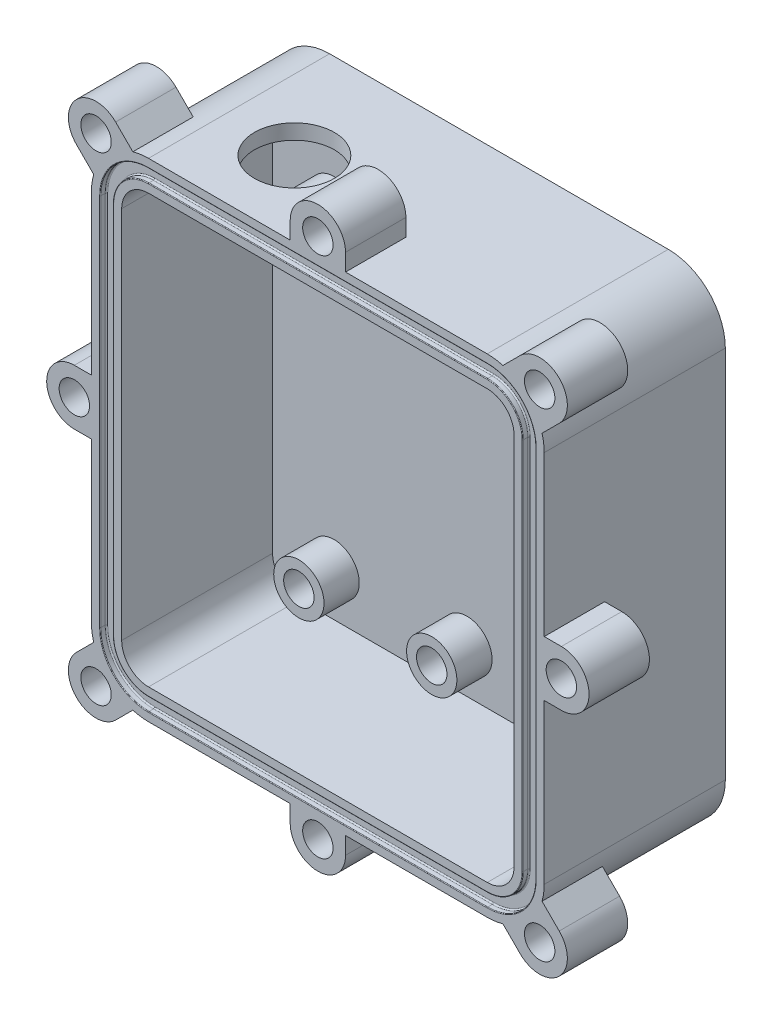
from build123d import *

# Parameters (mm, degrees)
BOSS_EXTRUDE1_DEPTH     = 30
SHELL1_T                = 6
CUT_EXTRUDE4_DEPTH      = 1.2446
FILLET1_R               = 0.254
FILLET2_R               = 0.127
BOSS_EXTRUDE7_START     = -12
BOSS_EXTRUDE7_DEPTH     = 12
SKETCH17_R              = 3.025
CUT_EXTRUDE5_DEPTH      = 9
MIRROR3_START           = -12
MIRROR3_COPY_1_DEPTH    = 12
MIRROR3_COPY_2_SKETCH_R = 3.025
MIRROR3_COPY_2_DEPTH    = 9
BOSS_EXTRUDE8_DEPTH     = 12
SKETCH19_R              = 3.025
CUT_EXTRUDE6_DEPTH      = 9
BOSS_EXTRUDE9_DEPTH     = 12
SKETCH21_R              = 3.025
CUT_EXTRUDE9_DEPTH      = 9
CUT_EXTRUDE12_DEPTH     = 6
SKETCH28_R              = 5
SKETCH28_R_2            = 3.025
BOSS_EXTRUDE12_DEPTH    = 7
SKETCH29_R              = 12.7
CUT_EXTRUDE13_DEPTH     = 3
SKETCH30_R              = 3.025
CUT_EXTRUDE14_DEPTH     = 9


with BuildPart() as part:
    # Sketch2 → Boss-Extrude1 (new body)
    with BuildSketch(Plane.XY):
        with BuildLine():
            Line((25.377997498, 138.848000793), (92.709997498, 138.848000793))
            ThreePointArc((92.709997498, 138.848000793), (96.481705068, 137.285708364), (98.043997498, 133.514000793))
            Line((98.043997498, 133.514000793), (98.043997498, 59.182000793))
            ThreePointArc((98.043997498, 59.182000793), (96.481705068, 55.410293223), (92.709997498, 53.848000793))
            Line((92.709997498, 53.848000793), (25.377997498, 53.848000793))
            ThreePointArc((25.377997498, 53.848000793), (21.606289927, 55.410293223), (20.043997498, 59.182000793))
            Line((20.043997498, 59.182000793), (20.043997498, 133.514000793))
            ThreePointArc((20.043997498, 133.514000793), (21.606289927, 137.285708364), (25.377997498, 138.848000793))
        make_face()
    extrude(amount=BOSS_EXTRUDE1_DEPTH)

    # Shell1
    shell1_openings = [part.faces().sort_by_distance(p)[0] for p in [
        (59.043997498, 96.348000793, 30),
    ]]
    offset(amount=SHELL1_T, openings=shell1_openings, kind=Kind.INTERSECTION)

    # Sketch15 → Cut-Extrude4 (cut)
    with BuildSketch(Plane.XY.offset(30)):
        with BuildLine():
            Line((92.709997498, 143.130700793), (25.377997498, 143.130700793))
            ThreePointArc((25.377997498, 143.130700793), (18.577963715, 140.314034576), (15.761297498, 133.514000793))
            Line((15.761297498, 133.514000793), (15.761297498, 59.182000793))
            ThreePointArc((15.761297498, 59.182000793), (18.577963715, 52.381967011), (25.377997498, 49.565300793))
            Line((25.377997498, 49.565300793), (92.709997498, 49.565300793))
            ThreePointArc((92.709997498, 49.565300793), (99.51003128, 52.381967011), (102.326697498, 59.182000793))
            Line((102.326697498, 59.182000793), (102.326697498, 133.514000793))
            ThreePointArc((102.326697498, 133.514000793), (99.51003128, 140.314034576), (92.709997498, 143.130700793))
        make_face()
        with BuildLine():
            Line((18.326697498, 133.514000793), (18.326697498, 59.182000793))
            ThreePointArc((18.326697498, 59.182000793), (20.391975451, 54.195978747), (25.377997498, 52.130700793))
            Line((25.377997498, 52.130700793), (92.709997498, 52.130700793))
            ThreePointArc((92.709997498, 52.130700793), (97.696019544, 54.195978747), (99.761297498, 59.182000793))
            Line((99.761297498, 59.182000793), (99.761297498, 133.514000793))
            ThreePointArc((99.761297498, 133.514000793), (97.696019544, 138.50002284), (92.709997498, 140.565300793))
            Line((92.709997498, 140.565300793), (25.377997498, 140.565300793))
            ThreePointArc((25.377997498, 140.565300793), (20.391975451, 138.50002284), (18.326697498, 133.514000793))
        make_face(mode=Mode.SUBTRACT)
    extrude(amount=-CUT_EXTRUDE4_DEPTH, mode=Mode.SUBTRACT)

    # Fillet1
    fillet1_edges = [part.edges().sort_by_distance(p)[0] for p in [
        (99.51003128, 140.314034576, 28.7554),
        (102.326697498, 96.348000793, 28.7554),
        (99.51003128, 52.381967011, 28.7554),
        (59.043997498, 49.565300793, 28.7554),
        (18.577963715, 52.381967011, 28.7554),
        (15.761297498, 96.348000793, 28.7554),
        (18.577963715, 140.314034576, 28.7554),
        (59.043997498, 143.130700793, 28.7554),
        (59.043997498, 140.565300793, 28.7554),
        (20.391975451, 138.50002284, 28.7554),
        (18.326697498, 96.348000793, 28.7554),
        (20.391975451, 54.195978747, 28.7554),
        (59.043997498, 52.130700793, 28.7554),
        (97.696019544, 54.195978747, 28.7554),
        (99.761297498, 96.348000793, 28.7554),
        (97.696019544, 138.50002284, 28.7554),
    ]]
    fillet(fillet1_edges, radius=FILLET1_R)

    # Fillet2
    fillet2_edges = [part.edges().sort_by_distance(p)[0] for p in [
        (99.51003128, 140.314034576, 30),
        (59.043997498, 143.130700793, 30),
        (18.577963715, 140.314034576, 30),
        (15.761297498, 96.348000793, 30),
        (18.577963715, 52.381967011, 30),
        (59.043997498, 49.565300793, 30),
        (99.51003128, 52.381967011, 30),
        (102.326697498, 96.348000793, 30),
        (20.391975451, 138.50002284, 30),
        (59.043997498, 140.565300793, 30),
        (97.696019544, 138.50002284, 30),
        (99.761297498, 96.348000793, 30),
        (97.696019544, 54.195978747, 30),
        (59.043997498, 52.130700793, 30),
        (20.391975451, 54.195978747, 30),
        (18.326697498, 96.348000793, 30),
    ]]
    fillet(fillet2_edges, radius=FILLET2_R)

    # Sketch16 → Boss-Extrude7 (add)
    with BuildSketch(Plane.XY.offset(30).offset(BOSS_EXTRUDE7_START)):
        with BuildLine():
            Line((100.996369734, 50.895628557), (100.724345756, 51.167652535))
            ThreePointArc((100.724345756, 51.167652535), (99.274143504, 49.942328548), (97.639754878, 48.976264751))
            ThreePointArc((97.639754878, 48.976264751), (98.013010145, 46.753769441), (99.246280451, 44.867543247))
            ThreePointArc((99.246280451, 44.867543247), (103.135367747, 43.256630544), (107.024455044, 44.867543247))
            Line((107.024455044, 44.867543247), (105.27436576, 46.617632531))
            ThreePointArc((105.27436576, 46.617632531), (100.996369734, 46.617632531), (100.996369734, 50.895628557))
        make_face()
        with BuildLine():
            ThreePointArc((102.91573354, 54.252243414), (101.949669743, 52.617854787), (100.724345756, 51.167652535))
            Line((100.724345756, 51.167652535), (100.996369734, 50.895628557))
            ThreePointArc((100.996369734, 50.895628557), (104.29298513, 51.55136613), (106.160367747, 48.756630544))
            ThreePointArc((106.160367747, 48.756630544), (105.930103333, 47.599013161), (105.27436576, 46.617632531))
            Line((105.27436576, 46.617632531), (107.024455044, 44.867543247))
            ThreePointArc((107.024455044, 44.867543247), (108.216705176, 46.651871666), (108.635367747, 48.756630544))
            ThreePointArc((108.635367747, 48.756630544), (108.216705176, 50.861389422), (107.024455044, 52.64571784))
            ThreePointArc((107.024455044, 52.64571784), (105.13822885, 53.878988146), (102.91573354, 54.252243414))
        make_face()
        with BuildLine():
            Line((100.724345756, 51.167652535), (99.599833841, 52.29216445))
            ThreePointArc((99.599833841, 52.29216445), (98.909730925, 51.665153375), (98.162855601, 51.106975828))
            ThreePointArc((98.162855601, 51.106975828), (97.793982837, 50.067968501), (97.639754878, 48.976264751))
            ThreePointArc((97.639754878, 48.976264751), (99.274143504, 49.942328548), (100.724345756, 51.167652535))
        make_face()
        with BuildLine():
            ThreePointArc((100.785022463, 53.72914269), (100.226844916, 52.982267366), (99.599833841, 52.29216445))
            Line((99.599833841, 52.29216445), (100.724345756, 51.167652535))
            ThreePointArc((100.724345756, 51.167652535), (101.949669743, 52.617854787), (102.91573354, 54.252243414))
            ThreePointArc((102.91573354, 54.252243414), (101.82402979, 54.098015454), (100.785022463, 53.72914269))
        make_face()
        with BuildLine():
            Line((105.27436576, 46.617632531), (100.996369734, 50.895628557))
            ThreePointArc((100.996369734, 50.895628557), (100.996369734, 46.617632531), (105.27436576, 46.617632531))
        make_face()
        with BuildLine():
            ThreePointArc((106.160367747, 48.756630544), (104.29298513, 51.55136613), (100.996369734, 50.895628557))
            Line((100.996369734, 50.895628557), (105.27436576, 46.617632531))
            ThreePointArc((105.27436576, 46.617632531), (105.930103333, 47.599013161), (106.160367747, 48.756630544))
        make_face()
        with BuildLine():
            ThreePointArc((99.246280451, 44.867543247), (98.013010145, 46.753769441), (97.639754878, 48.976264751))
            ThreePointArc((97.639754878, 48.976264751), (96.748870179, 48.592049733), (95.828390347, 48.285433351))
            Line((95.828390347, 48.285433351), (99.246280451, 44.867543247))
        make_face()
        with BuildLine():
            ThreePointArc((103.60656494, 56.063607944), (103.299948558, 55.143128112), (102.91573354, 54.252243414))
            ThreePointArc((102.91573354, 54.252243414), (105.13822885, 53.878988146), (107.024455044, 52.64571784))
            Line((107.024455044, 52.64571784), (103.60656494, 56.063607944))
        make_face()
    boss_extrude7 = extrude(amount=BOSS_EXTRUDE7_DEPTH)

    # Sketch17 → Cut-Extrude5 (cut)
    with BuildSketch(Plane.XY.offset(30)):
        with Locations((103.135367747, 48.756630544)):
            Circle(SKETCH17_R)
    cut_extrude5 = extrude(amount=-CUT_EXTRUDE5_DEPTH, mode=Mode.SUBTRACT)

    # Mirror2: Boss-Extrude7, Cut-Extrude5 across plane
    add(boss_extrude7.mirror(Plane(origin=(0, 96.348000793, 0), x_dir=(0, 0, 1), z_dir=(0, -1, 0))))
    add(cut_extrude5.mirror(Plane(origin=(0, 96.348000793, 0), x_dir=(0, 0, 1), z_dir=(0, -1, 0))), mode=Mode.SUBTRACT)

    # Mirror3: Boss-Extrude7, Cut-Extrude5 across plane
    add(boss_extrude7.mirror(Plane(origin=(59.043997498, 0, 0), x_dir=(0, 0, 1), z_dir=(1, 0, 0))))
    add(cut_extrude5.mirror(Plane(origin=(59.043997498, 0, 0), x_dir=(0, 0, 1), z_dir=(1, 0, 0))), mode=Mode.SUBTRACT)

    # Mirror3 copy 1 sketch → Mirror3 copy 1 (add)
    with BuildSketch(Plane(origin=(118.087994995, 192.696001587, 30), x_dir=(-1, 0, 0), z_dir=(0, 0, 1)).offset(MIRROR3_START)):
        with BuildLine():
            Line((100.996369734, 50.895628557), (100.724345756, 51.167652535))
            ThreePointArc((100.724345756, 51.167652535), (99.274143504, 49.942328548), (97.639754878, 48.976264751))
            ThreePointArc((97.639754878, 48.976264751), (98.013010145, 46.753769441), (99.246280451, 44.867543247))
            ThreePointArc((99.246280451, 44.867543247), (103.135367747, 43.256630544), (107.024455044, 44.867543247))
            Line((107.024455044, 44.867543247), (105.27436576, 46.617632531))
            ThreePointArc((105.27436576, 46.617632531), (100.996369734, 46.617632531), (100.996369734, 50.895628557))
        make_face()
        with BuildLine():
            ThreePointArc((102.91573354, 54.252243414), (101.949669743, 52.617854787), (100.724345756, 51.167652535))
            Line((100.724345756, 51.167652535), (100.996369734, 50.895628557))
            ThreePointArc((100.996369734, 50.895628557), (104.29298513, 51.55136613), (106.160367747, 48.756630544))
            ThreePointArc((106.160367747, 48.756630544), (105.930103333, 47.599013161), (105.27436576, 46.617632531))
            Line((105.27436576, 46.617632531), (107.024455044, 44.867543247))
            ThreePointArc((107.024455044, 44.867543247), (108.216705176, 46.651871666), (108.635367747, 48.756630544))
            ThreePointArc((108.635367747, 48.756630544), (108.216705176, 50.861389422), (107.024455044, 52.64571784))
            ThreePointArc((107.024455044, 52.64571784), (105.13822885, 53.878988146), (102.91573354, 54.252243414))
        make_face()
        with BuildLine():
            Line((100.724345756, 51.167652535), (99.599833841, 52.29216445))
            ThreePointArc((99.599833841, 52.29216445), (98.909730925, 51.665153375), (98.162855601, 51.106975828))
            ThreePointArc((98.162855601, 51.106975828), (97.793982837, 50.067968501), (97.639754878, 48.976264751))
            ThreePointArc((97.639754878, 48.976264751), (99.274143504, 49.942328548), (100.724345756, 51.167652535))
        make_face()
        with BuildLine():
            ThreePointArc((100.785022463, 53.72914269), (100.226844916, 52.982267366), (99.599833841, 52.29216445))
            Line((99.599833841, 52.29216445), (100.724345756, 51.167652535))
            ThreePointArc((100.724345756, 51.167652535), (101.949669743, 52.617854787), (102.91573354, 54.252243414))
            ThreePointArc((102.91573354, 54.252243414), (101.82402979, 54.098015454), (100.785022463, 53.72914269))
        make_face()
        with BuildLine():
            Line((105.27436576, 46.617632531), (100.996369734, 50.895628557))
            ThreePointArc((100.996369734, 50.895628557), (100.996369734, 46.617632531), (105.27436576, 46.617632531))
        make_face()
        with BuildLine():
            ThreePointArc((106.160367747, 48.756630544), (104.29298513, 51.55136613), (100.996369734, 50.895628557))
            Line((100.996369734, 50.895628557), (105.27436576, 46.617632531))
            ThreePointArc((105.27436576, 46.617632531), (105.930103333, 47.599013161), (106.160367747, 48.756630544))
        make_face()
        with BuildLine():
            ThreePointArc((99.246280451, 44.867543247), (98.013010145, 46.753769441), (97.639754878, 48.976264751))
            ThreePointArc((97.639754878, 48.976264751), (96.748870179, 48.592049733), (95.828390347, 48.285433351))
            Line((95.828390347, 48.285433351), (99.246280451, 44.867543247))
        make_face()
        with BuildLine():
            ThreePointArc((103.60656494, 56.063607944), (103.299948558, 55.143128112), (102.91573354, 54.252243414))
            ThreePointArc((102.91573354, 54.252243414), (105.13822885, 53.878988146), (107.024455044, 52.64571784))
            Line((107.024455044, 52.64571784), (103.60656494, 56.063607944))
        make_face()
    extrude(amount=MIRROR3_COPY_1_DEPTH)

    # Mirror3 copy 2 sketch → Mirror3 copy 2 (cut)
    with BuildSketch(Plane(origin=(118.087994995, 192.696001587, 30), x_dir=(-1, 0, 0), z_dir=(0, 0, 1))):
        with Locations((103.135367747, 48.756630544)):
            Circle(MIRROR3_COPY_2_SKETCH_R)
    extrude(amount=-MIRROR3_COPY_2_DEPTH, mode=Mode.SUBTRACT)

    # Sketch18 → Boss-Extrude8 (add)
    with BuildSketch(Plane.XY.offset(30)):
        with BuildLine():
            Line((64.543997498, 47.848000793), (53.543997498, 47.848000793))
            Line((53.543997498, 47.848000793), (53.543997498, 44.438300793))
            ThreePointArc((53.543997498, 44.438300793), (59.043997498, 38.938300793), (64.543997498, 44.438300793))
            Line((64.543997498, 44.438300793), (64.543997498, 47.848000793))
        make_face()
    boss_extrude8 = extrude(amount=-BOSS_EXTRUDE8_DEPTH)

    # Sketch19 → Cut-Extrude6 (cut)
    with BuildSketch(Plane.XY.offset(30)):
        with Locations((59.043997498, 44.438300793)):
            Circle(SKETCH19_R)
    cut_extrude6 = extrude(amount=-CUT_EXTRUDE6_DEPTH, mode=Mode.SUBTRACT)

    # Mirror4: Boss-Extrude8, Cut-Extrude6 across plane
    add(boss_extrude8.mirror(Plane(origin=(0, 96.348000793, 0), x_dir=(0, 0, 1), z_dir=(0, -1, 0))))
    add(cut_extrude6.mirror(Plane(origin=(0, 96.348000793, 0), x_dir=(0, 0, 1), z_dir=(0, -1, 0))), mode=Mode.SUBTRACT)

    # Sketch20 → Boss-Extrude9 (add)
    with BuildSketch(Plane.XY.offset(30)):
        with BuildLine():
            Line((104.043997498, 101.848000793), (104.043997498, 90.848000793))
            Line((104.043997498, 90.848000793), (107.453697498, 90.848000793))
            ThreePointArc((107.453697498, 90.848000793), (112.953697498, 96.348000793), (107.453697498, 101.848000793))
            Line((107.453697498, 101.848000793), (104.043997498, 101.848000793))
        make_face()
    boss_extrude9 = extrude(amount=-BOSS_EXTRUDE9_DEPTH)

    # Mirror5: Boss-Extrude9 across plane
    add(boss_extrude9.mirror(Plane(origin=(59.043997498, 0, 0), x_dir=(0, 0, 1), z_dir=(1, 0, 0))))

    # Sketch21 → Cut-Extrude9 (cut)
    with BuildSketch(Plane.XY.offset(30)):
        with Locations((10.634297498, 96.348000793)):
            Circle(SKETCH21_R)
    extrude(amount=-CUT_EXTRUDE9_DEPTH, mode=Mode.SUBTRACT)

    # Sketch27 → Cut-Extrude12 (cut)
    with BuildSketch(Plane(origin=(0, 144.848000793, 0), x_dir=(1, 0, 0), z_dir=(0, 1, 0))):
        with BuildLine():
            ThreePointArc((46.726732508, -12), (39.377997498, -7.0625), (32.029262487, -12))
            Line((32.029262487, -12), (46.726732508, -12))
        make_face()
        with BuildLine():
            Line((46.726732508, -12), (32.029262487, -12))
            ThreePointArc((32.029262487, -12), (37.849383402, -22.788918102), (47.315497498, -15))
            ThreePointArc((47.315497498, -15), (47.166915599, -13.471385904), (46.726732508, -12))
        make_face()
    extrude(amount=-CUT_EXTRUDE12_DEPTH, mode=Mode.SUBTRACT)

    # Sketch28 → Boss-Extrude12 (add)
    # profile 1 of 6: a face of its own
    with BuildSketch(Plane.XY):
        with Locations(Location((32.265998756, 125.158, 0), (0, 0, 180))):
            Circle(SKETCH28_R)
        with Locations((32.265998756, 125.158)):
            Circle(SKETCH28_R_2, mode=Mode.SUBTRACT)
    # profile 2 of 6: a face of its own
    with BuildSketch(Plane.XY):
        with Locations(Location((58.681998756, 125.158, 0), (0, 0, 180))):
            Circle(SKETCH28_R)
        with Locations((58.681998756, 125.158)):
            Circle(SKETCH28_R_2, mode=Mode.SUBTRACT)
    # profile 3 of 6: a face of its own
    with BuildSketch(Plane.XY):
        with Locations(Location((86.113998756, 125.158, 0), (0, 0, 180))):
            Circle(SKETCH28_R)
        with Locations((86.113998756, 125.158)):
            Circle(SKETCH28_R_2, mode=Mode.SUBTRACT)
    # profile 4 of 6: a face of its own
    with BuildSketch(Plane.XY):
        with Locations(Location((32.265998756, 62.674, 0), (0, 0, 180))):
            Circle(SKETCH28_R)
        with Locations((32.265998756, 62.674)):
            Circle(SKETCH28_R_2, mode=Mode.SUBTRACT)
    # profile 5 of 6: a face of its own
    with BuildSketch(Plane.XY):
        with Locations(Location((58.681998756, 62.674, 0), (0, 0, 180))):
            Circle(SKETCH28_R)
        with Locations((58.681998756, 62.674)):
            Circle(SKETCH28_R_2, mode=Mode.SUBTRACT)
    # profile 6 of 6: a face of its own
    with BuildSketch(Plane.XY):
        with Locations(Location((86.113998756, 62.674, 0), (0, 0, 180))):
            Circle(SKETCH28_R)
        with Locations((86.113998756, 62.674)):
            Circle(SKETCH28_R_2, mode=Mode.SUBTRACT)
    extrude(amount=BOSS_EXTRUDE12_DEPTH)

    # Sketch29 → Cut-Extrude13 (cut)
    with BuildSketch(Plane.XZ.offset(-138.848000793)):
        with Locations(Location((39.377997498, 15, 0), (0, 0, 270))):
            Circle(SKETCH29_R)
    extrude(amount=-CUT_EXTRUDE13_DEPTH, mode=Mode.SUBTRACT)

    # Sketch30 → Cut-Extrude14 (cut)
    with BuildSketch(Plane.XY.offset(30)):
        with Locations((107.453697498, 96.348000793)):
            Circle(SKETCH30_R)
    extrude(amount=-CUT_EXTRUDE14_DEPTH, mode=Mode.SUBTRACT)


solid = part.part
